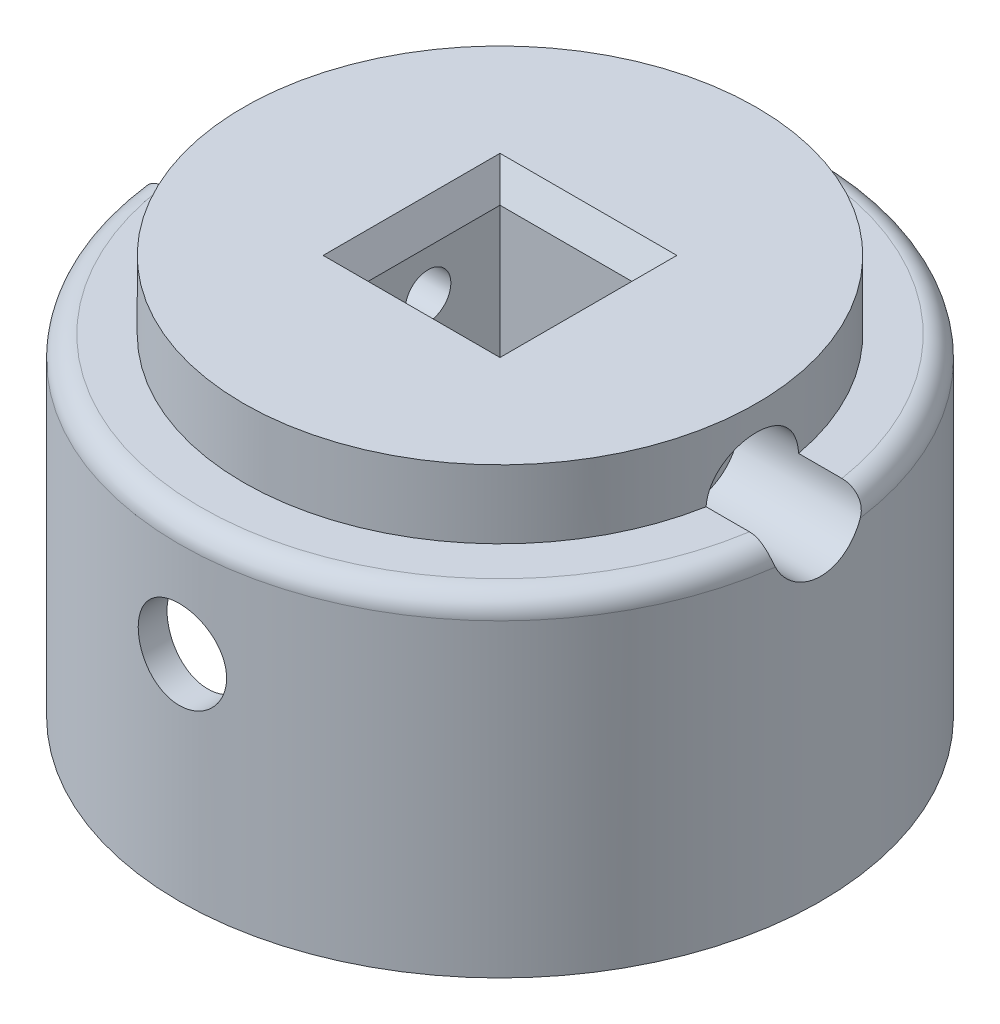
from build123d import *
from OCP.BRepFilletAPI import BRepFilletAPI_MakeChamfer

# Parameters (mm, degrees)
SKETCH1_R                = 22.5
BOSS_EXTRUDE1_DEPTH      = 28
SKETCH2_W                = 10.1
SKETCH2_H                = 10.1
CUT_EXTRUDE2_DEPTH       = 43.385138905
SHELL3_T                 = -2
SKETCH3_R                = 3.1
CUT_EXTRUDE3_DEPTH       = 47.51292831
CHAMFER1_SIZE            = 2
CHAMFER1_SIZE2           = 1.154700538
BOSS_EXTRUDE8_START      = 23
BOSS_EXTRUDE8_DEPTH      = 23
BOSS_EXTRUDE4_DEPTH      = 20
BOSS_EXTRUDE6_DEPTH      = 26
CUT_EXTRUDE5_DEPTH       = 12
CUT_EXTRUDE9_DEPTH       = 2
BOSS_EXTRUDE10_START     = 7
BOSS_EXTRUDE10_DEPTH     = 7
SKETCH21_OUTSIDE_W       = 61.262
SKETCH21_OUTSIDE_H       = 63.965
SKETCH21_OUTSIDE_R       = 18
CUT_EXTRUDE11_DEPTH      = 4.8
CUT_EXTRUDE12_DEPTH      = 47.67125763
CUT_EXTRUDE12_DEPTH_BACK = 47.67125763
SKETCH22_R               = 1.6
CUT_EXTRUDE13_START      = -8.5
SKETCH24_R               = 3.25
CUT_EXTRUDE13_DEPTH      = 39.17125769
CUT_EXTRUDE14_START      = -8.5
CUT_EXTRUDE14_DEPTH      = 39.171257692
FILLET1_R                = 1.5
SKETCH26_R               = 43.919943133
SKETCH26_R_2             = 22.5
CUT_EXTRUDE15_DEPTH      = 44.879993089
CHAMFER2_SIZE            = 0.5
CHAMFER2_SIZE2           = 1.37373871


with BuildPart() as part:
    # Sketch1 → Boss-Extrude1 (new body)
    with BuildSketch(Plane(origin=(0, 0, 0), x_dir=(1, 0, 0), z_dir=(0, 1, 0))):
        with Locations(Location((0, 0, 0), (0, 0, 270))):
            Circle(SKETCH1_R)
    extrude(amount=BOSS_EXTRUDE1_DEPTH)

    # Sketch2 → Cut-Extrude2 (cut, through all)
    with BuildSketch(Plane.XZ):
        Rectangle(SKETCH2_W, SKETCH2_H)
    extrude(amount=-CUT_EXTRUDE2_DEPTH, mode=Mode.SUBTRACT)

    # Shell3
    shell3_openings = [part.faces().sort_by_distance(p)[0] for p in [
        (0, 0, -21.863603897),
    ]]
    offset(amount=SHELL3_T, openings=shell3_openings, kind=Kind.INTERSECTION)

    # Sketch3 → Cut-Extrude3 (cut, through all)
    with BuildSketch(Plane.XY.offset(7.05)):
        with Locations(Location((0, 15, 0), (0, 0, 270.000000016))):
            Circle(SKETCH3_R)
    extrude(amount=CUT_EXTRUDE3_DEPTH, mode=Mode.SUBTRACT)

    # Chamfer1: one chamfer whose edges measure the first distance from different faces: ONE call of the kernel's chamfer builder (chamfer() names one face for all edges)
    chamfer1_edges_1 = [part.edges().sort_by_distance(p)[0] for p in [
        (5.05, 28, 0),
    ]]
    chamfer1_side_1 = [part.faces().sort_by_distance(p)[0] for p in [
        (5.05, 14, 0),
    ]]
    chamfer1_edges_2 = [part.edges().sort_by_distance(p)[0] for p in [
        (0, 28, -5.05),
    ]]
    chamfer1_side_2 = [part.faces().sort_by_distance(p)[0] for p in [
        (0, 14, -5.05),
    ]]
    chamfer1_edges_3 = [part.edges().sort_by_distance(p)[0] for p in [
        (-5.05, 28, 0),
    ]]
    chamfer1_side_3 = [part.faces().sort_by_distance(p)[0] for p in [
        (-5.05, 14, 0),
    ]]
    chamfer1_edges_4 = [part.edges().sort_by_distance(p)[0] for p in [
        (0, 28, 5.05),
    ]]
    chamfer1_side_4 = [part.faces().sort_by_distance(p)[0] for p in [
        (0, 14, 5.05),
    ]]
    chamfer1 = BRepFilletAPI_MakeChamfer(part.part.solid().wrapped)
    for e in chamfer1_edges_1:
        chamfer1.Add(CHAMFER1_SIZE, CHAMFER1_SIZE2, e.wrapped, chamfer1_side_1[0].wrapped)  # the first distance lies on this face
    for e in chamfer1_edges_2:
        chamfer1.Add(CHAMFER1_SIZE, CHAMFER1_SIZE2, e.wrapped, chamfer1_side_2[0].wrapped)  # the first distance lies on this face
    for e in chamfer1_edges_3:
        chamfer1.Add(CHAMFER1_SIZE, CHAMFER1_SIZE2, e.wrapped, chamfer1_side_3[0].wrapped)  # the first distance lies on this face
    for e in chamfer1_edges_4:
        chamfer1.Add(CHAMFER1_SIZE, CHAMFER1_SIZE2, e.wrapped, chamfer1_side_4[0].wrapped)  # the first distance lies on this face
    add(Compound.cast(chamfer1.Shape()), mode=Mode.REPLACE)

    # Sketch18 → Boss-Extrude8 (add)
    with BuildSketch(Plane.XZ.offset(-26).offset(BOSS_EXTRUDE8_START)):
        with BuildLine():
            Line((-15.72889581, -7.671495069), (-18.425277949, -8.986608509))
            ThreePointArc((-18.425277949, -8.986608509), (-20.471905462, 1.072887103), (-17.384985971, 10.863344917))
            Line((-17.384985971, 10.863344917), (-14.840841683, 9.273587124))
            ThreePointArc((-14.840841683, 9.273587124), (-17.476016858, 0.915879234), (-15.72889581, -7.671495069))
        make_face()
    extrude(amount=-BOSS_EXTRUDE8_DEPTH)

    # Sketch9 → Boss-Extrude4 (add)
    with BuildSketch(Plane.XZ):
        Polygon((2.070380013, -22.404542544), (-16.587666088, -15.201951643), (-17.668054723, -18.000658558), (0.989991378, -25.203249459), align=None)
    extrude(amount=-BOSS_EXTRUDE4_DEPTH)

    # Sketch11 → Boss-Extrude6 (add)
    with BuildSketch(Plane.XZ):
        with BuildLine():
            Line((2.070380013, -22.404542544), (7.05, -7.05))
            Line((7.05, -7.05), (-7.05, -7.05))
            Line((-7.05, -7.05), (-16.587666088, -15.201951643))
            ThreePointArc((-16.587666088, -15.201951643), (-8.102914764, -20.990301864), (2.070380013, -22.404542544))
        make_face()
    extrude(amount=-BOSS_EXTRUDE6_DEPTH)

    # Sketch12 → Cut-Extrude5 (cut)
    with BuildSketch(Plane.XZ):
        with BuildLine():
            Line((3.795196001, -17.086112517), (2.74804579, -20.314975863))
            ThreePointArc((2.74804579, -20.314975863), (-6.94389773, -19.288138436), (-15.066327631, -13.901646367))
            Line((-15.066327631, -13.901646367), (-12.785820172, -11.952470714))
            ThreePointArc((-12.785820172, -11.952470714), (-5.176523958, -16.719520129), (3.795196001, -17.086112517))
        make_face()
    extrude(amount=-CUT_EXTRUDE5_DEPTH, mode=Mode.SUBTRACT)

    # Sketch17 → Cut-Extrude9 (cut)
    with BuildSketch(Plane.XZ):
        with BuildLine():
            Line((7.05, 7.05), (7.05, -7.05))
            Line((7.05, -7.05), (3.795196001, -17.086112517))
            ThreePointArc((3.795196001, -17.086112517), (-5.176523958, -16.719520129), (-12.785820172, -11.952470714))
            Line((-12.785820172, -11.952470714), (-7.05, -7.05))
            Line((-7.05, -7.05), (-7.05, 7.05))
            Line((-7.05, 7.05), (7.05, 7.05))
        make_face()
    extrude(amount=-CUT_EXTRUDE9_DEPTH, mode=Mode.SUBTRACT)

    # Sketch20 → Boss-Extrude10 (add)
    with BuildSketch(Plane.XZ.offset(-26).offset(BOSS_EXTRUDE10_START)):
        with BuildLine():
            Line((2.74804579, -20.314975863), (7.05, -7.05))
            Line((7.05, -7.05), (7.05, 7.05))
            Line((7.05, 7.05), (-7.05, 7.05))
            Line((-7.05, 7.05), (-7.05, -7.05))
            Line((-7.05, -7.05), (-15.066327631, -13.901646367))
            ThreePointArc((-15.066327631, -13.901646367), (6.94389773, 19.288138436), (2.74804579, -20.314975863))
        make_face()
    extrude(amount=-BOSS_EXTRUDE10_DEPTH)

    # Sketch21 outside → Cut-Extrude11 (cut)
    with BuildSketch(Plane(origin=(0, 28, 0), x_dir=(1, 0, 0), z_dir=(0, 1, 0))):
        with Locations((0, 1.3515)):
            Rectangle(SKETCH21_OUTSIDE_W, SKETCH21_OUTSIDE_H)
        with Locations(Location((0, 0, 0), (0, 0, 270))):
            Circle(SKETCH21_OUTSIDE_R, mode=Mode.SUBTRACT)
    extrude(amount=-CUT_EXTRUDE11_DEPTH, mode=Mode.SUBTRACT)

    # Sketch22 → Cut-Extrude12 (cut, two sides: drawn at the far end of the back side and taken through both)
    with BuildSketch(Plane.ZY.offset(-5.05).offset(-CUT_EXTRUDE12_DEPTH_BACK)):
        with Locations((0, 23)):
            Circle(SKETCH22_R)
    extrude(amount=CUT_EXTRUDE12_DEPTH + CUT_EXTRUDE12_DEPTH_BACK, mode=Mode.SUBTRACT)

    # Sketch24 → Cut-Extrude13 (cut, through all)
    with BuildSketch(Plane.ZY.offset(-5.05).offset(CUT_EXTRUDE13_START)):
        with Locations((0, 23)):
            Circle(SKETCH24_R)
    extrude(amount=-CUT_EXTRUDE13_DEPTH, mode=Mode.SUBTRACT)

    # Sketch25 → Cut-Extrude14 (cut, through all)
    with BuildSketch(Plane(origin=(-5.05, 0, 0), x_dir=(0, 0, -1), z_dir=(1, 0, 0)).offset(CUT_EXTRUDE14_START)):
        Polygon((0, 19.75), (2.814582562, 21.375), (2.814582562, 24.625), (0, 26.25), (-2.814582562, 24.625), (-2.814582562, 21.375), align=None)
    extrude(amount=-CUT_EXTRUDE14_DEPTH, mode=Mode.SUBTRACT)

    # Fillet1
    # the kernel refuses this fillet: 1.5 mm, written as the material it takes off along each edge
    with BuildSketch(Plane(origin=(0, 23.2, 0), x_dir=(0, 0, 1), z_dir=(1, 0, 0))) as fillet1_piece_1:
        with BuildLine():
            CenterArc((22.5 - FILLET1_R, FILLET1_R), FILLET1_R, 270, 90)
            Line((22.5, FILLET1_R), (22.5, 0))
            Line((22.5, 0), (22.5 - FILLET1_R, 0))
        make_face()
    revolve(axis=Axis((0, 23.2, 0), (0, -1, 0)), revolution_arc=92.366443414, mode=Mode.SUBTRACT)
    with BuildSketch(Plane(origin=(0, 23.2, 0), x_dir=(-0.9991402664664062, 0, 0.041457543649361384), z_dir=(0.041457543649361384, 0, 0.9991402664664062))) as fillet1_piece_2:
        with BuildLine():
            CenterArc((22.5 - FILLET1_R, FILLET1_R), FILLET1_R, 270, 90)
            Line((22.5, FILLET1_R), (22.5, 0))
            Line((22.5, 0), (22.5 - FILLET1_R, 0))
        make_face()
    revolve(axis=Axis((0, 23.2, 0), (0, -1, 0)), revolution_arc=183.648889302, mode=Mode.SUBTRACT)
    with BuildSketch(Plane(origin=(0, 23.2, 0), x_dir=(0.9997569746526436, 0, -0.022045217925738058), z_dir=(-0.022045217925738058, 0, -0.9997569746526436))) as fillet1_piece_3:
        with BuildLine():
            CenterArc((22.5 - FILLET1_R, FILLET1_R), FILLET1_R, 270, 90)
            Line((22.5, FILLET1_R), (22.5, 0))
            Line((22.5, 0), (22.5 - FILLET1_R, 0))
        make_face()
    revolve(axis=Axis((0, 23.2, 0), (0, -1, 0)), revolution_arc=91.263200277, mode=Mode.SUBTRACT)

    # Sketch26 → Cut-Extrude15 (cut, through all)
    with BuildSketch(Plane.XZ):
        Circle(SKETCH26_R)
        with Locations(Location((0, 0, 0), (0, 0, 352.392535773))):
            Circle(SKETCH26_R_2, mode=Mode.SUBTRACT)
    extrude(amount=-CUT_EXTRUDE15_DEPTH, mode=Mode.SUBTRACT)

    # Chamfer2
    chamfer2_edges = [part.edges().sort_by_distance(p)[0] for p in [
        (0, 2, 5.05),
        (-5.05, 2, 0),
        (0, 2, -5.05),
        (5.05, 2, 0),
    ]]
    chamfer2_side = [part.faces().sort_by_distance(p)[0] for p in [
        (-1.341973038, 2, -7.273001119),
    ]]
    chamfer(chamfer2_edges, length=CHAMFER2_SIZE, length2=CHAMFER2_SIZE2, reference=chamfer2_side[0])


solid = part.part
